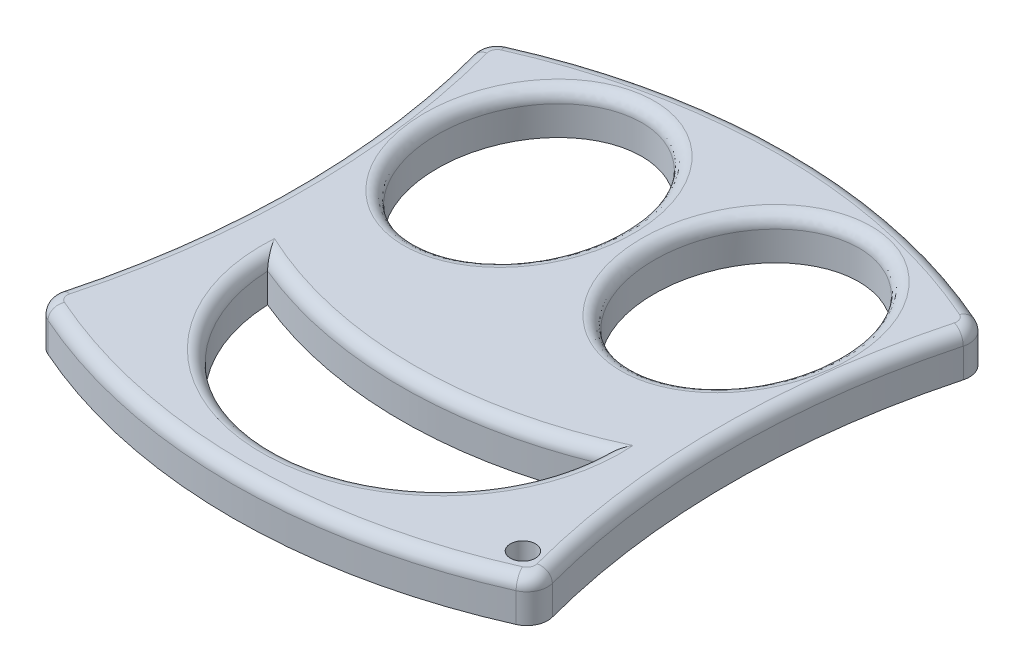
from build123d import *

# Parameters (mm, degrees)
SCHIZZO1_R                   = 1.5
SCHIZZO1_RX                  = 13.5
SCHIZZO1_RY                  = 11
ESTRUSIONE_ESTRUSIONE1_DEPTH = 5
RACCORDO1_R                  = 1.5
RACCORDO3_START              = -1
RACCORDO3_DEPTH              = 7
RACCORDO3_2_ANGLE            = 81.075888
RACCORDO3_3_ANGLE            = 81.075888
RACCORDO3_4_ANGLE            = 81.075888
RACCORDO3_5_ANGLE            = 81.075888


with BuildPart() as part:
    # Schizzo1 → Estrusione-Estrusione1 (new body)
    with BuildSketch(Plane(origin=(0, 0, 0), x_dir=(1, 0, 0), z_dir=(0, 1, 0))):
        with BuildLine():
            ThreePointArc((-30, 24.06625725), (0, 30.903282015), (30, 24.06625725))
            ThreePointArc((30, 24.06625725), (26.205041341, -2.562032416), (30, -29.190322083))
            ThreePointArc((30, -29.190322083), (0, -36.027346848), (-30, -29.190322083))
            ThreePointArc((-30, -29.190322083), (-26.205041341, -2.562032416), (-30, 24.06625725))
        make_face()
        with Locations(Location((25.814738983, -27.071033032, 0), (0, 0, 270))):
            Circle(SCHIZZO1_R, mode=Mode.SUBTRACT)
        with Locations(Location((-13, 12.472653152), (0, 0, 90))):
            Ellipse(SCHIZZO1_RX, SCHIZZO1_RY, mode=Mode.SUBTRACT)
        with Locations(Location((13, 12.472653152), (0, 0, 90))):
            Ellipse(SCHIZZO1_RX, SCHIZZO1_RY, mode=Mode.SUBTRACT)
        with BuildLine():
            ThreePointArc((-20, -11.828617148), (0, -15.828617148), (20, -11.828617148))
            ThreePointArc((20, -11.828617148), (0, -31.027346848), (-20, -11.828617148))
        make_face(mode=Mode.SUBTRACT)
    extrude(amount=ESTRUSIONE_ESTRUSIONE1_DEPTH)

    # Raccordo1
    raccordo1_edges = [part.edges().sort_by_distance(p)[0] for p in [
        (-26.205041341, 5, 2.562032416),
        (13.001315842, 5, 1.027346751),
        (0, 5, 36.027346848),
        (-12.998684158, 5, 1.027346751),
        (0, 5, 31.027346848),
        (0, 5, 15.828617148),
        (26.205041341, 5, 2.562032416),
        (0, 5, -30.903282015),
    ]]
    fillet(raccordo1_edges, radius=RACCORDO1_R)

    # Raccordo3: read off the stored shape, not the designer's step
    # Raccordo3 outline → Raccordo3 (cut)
    with BuildSketch(Plane(origin=(0, 0, 0), x_dir=(1, 0, 0), z_dir=(0, 1, 0)).offset(RACCORDO3_START)):
        with BuildLine():
            ThreePointArc((-29.435535694, 22.043301517), (-29.275250164, 23.768007937), (-28.032461563, 24.974565097))
            ThreePointArc((-28.032461563, 24.974565097), (-29.019784709, 24.528109542), (-30, 24.06625725))
            ThreePointArc((-30, 24.06625725), (-29.712196058, 23.056334077), (-29.435535694, 22.043301517))
        make_face()
        with BuildLine():
            ThreePointArc((30, 24.06625725), (29.019784709, 24.528109542), (28.032461563, 24.974565097))
            ThreePointArc((28.032461563, 24.974565097), (29.275250164, 23.768007937), (29.435535694, 22.043301517))
            ThreePointArc((29.435535694, 22.043301517), (29.712196058, 23.056334077), (30, 24.06625725))
        make_face()
        with BuildLine():
            ThreePointArc((-28.032461563, -30.09862993), (-29.275250164, -28.89207277), (-29.435535694, -27.16736635))
            ThreePointArc((-29.435535694, -27.16736635), (-29.712196058, -28.18039891), (-30, -29.190322083))
            ThreePointArc((-30, -29.190322083), (-29.019784709, -29.652174375), (-28.032461563, -30.09862993))
        make_face()
        with BuildLine():
            ThreePointArc((30, -29.190322083), (29.712196058, -28.18039891), (29.435535694, -27.16736635))
            ThreePointArc((29.435535694, -27.16736635), (29.275250164, -28.89207277), (28.032461563, -30.09862993))
            ThreePointArc((28.032461563, -30.09862993), (29.019784709, -29.652174375), (30, -29.190322083))
        make_face()
    extrude(amount=RACCORDO3_DEPTH, mode=Mode.SUBTRACT)

    # Raccordo3 2 outline → Raccordo3 2 (revolve, cut)
    with BuildSketch(Plane(origin=(-27.020263703, 0, -22.688639575), x_dir=(-0.4048791441074497, 0, -0.9143702087594603), z_dir=(0.9143702087594603, 0, -0.4048791441074497))):
        with BuildLine():
            ThreePointArc((1, 5), (2.060660172, 4.560660172), (2.5, 3.5))
            Line((2.5, 3.5), (2.5, 5))
            Line((2.5, 5), (1, 5))
        make_face()
    revolve(axis=Axis((-27.020263703, 0, -22.688639575), (0, 1, 0)), revolution_arc=RACCORDO3_2_ANGLE, mode=Mode.SUBTRACT)

    # Raccordo3 3 outline → Raccordo3 3 (revolve, cut)
    with BuildSketch(Plane(origin=(27.020263703, 0, -22.688639575), x_dir=(0.9661087964600781, 0, 0.2581352230952981), z_dir=(-0.2581352230952981, 0, 0.9661087964600781))):
        with BuildLine():
            ThreePointArc((1, 5), (2.060660172, 4.560660172), (2.5, 3.5))
            Line((2.5, 3.5), (2.5, 5))
            Line((2.5, 5), (1, 5))
        make_face()
    revolve(axis=Axis((27.020263703, 0, -22.688639575), (0, 1, 0)), revolution_arc=RACCORDO3_3_ANGLE, mode=Mode.SUBTRACT)

    # Raccordo3 4 outline → Raccordo3 4 (revolve, cut)
    with BuildSketch(Plane(origin=(27.020263703, 0, 27.812704408), x_dir=(0.4048791441074346, 0, 0.914370208759467), z_dir=(-0.914370208759467, 0, 0.4048791441074346))):
        with BuildLine():
            ThreePointArc((1, 5), (2.060660172, 4.560660172), (2.5, 3.5))
            Line((2.5, 3.5), (2.5, 5))
            Line((2.5, 5), (1, 5))
        make_face()
    revolve(axis=Axis((27.020263703, 0, 27.812704408), (0, 1, 0)), revolution_arc=RACCORDO3_4_ANGLE, mode=Mode.SUBTRACT)

    # Raccordo3 5 outline → Raccordo3 5 (revolve, cut)
    with BuildSketch(Plane(origin=(-27.020263703, 0, 27.812704408), x_dir=(-0.9661087964600926, 0, -0.2581352230952439), z_dir=(0.2581352230952439, 0, -0.9661087964600926))):
        with BuildLine():
            ThreePointArc((1, 5), (2.060660172, 4.560660172), (2.5, 3.5))
            Line((2.5, 3.5), (2.5, 5))
            Line((2.5, 5), (1, 5))
        make_face()
    revolve(axis=Axis((-27.020263703, 0, 27.812704408), (0, 1, 0)), revolution_arc=RACCORDO3_5_ANGLE, mode=Mode.SUBTRACT)


solid = part.part
